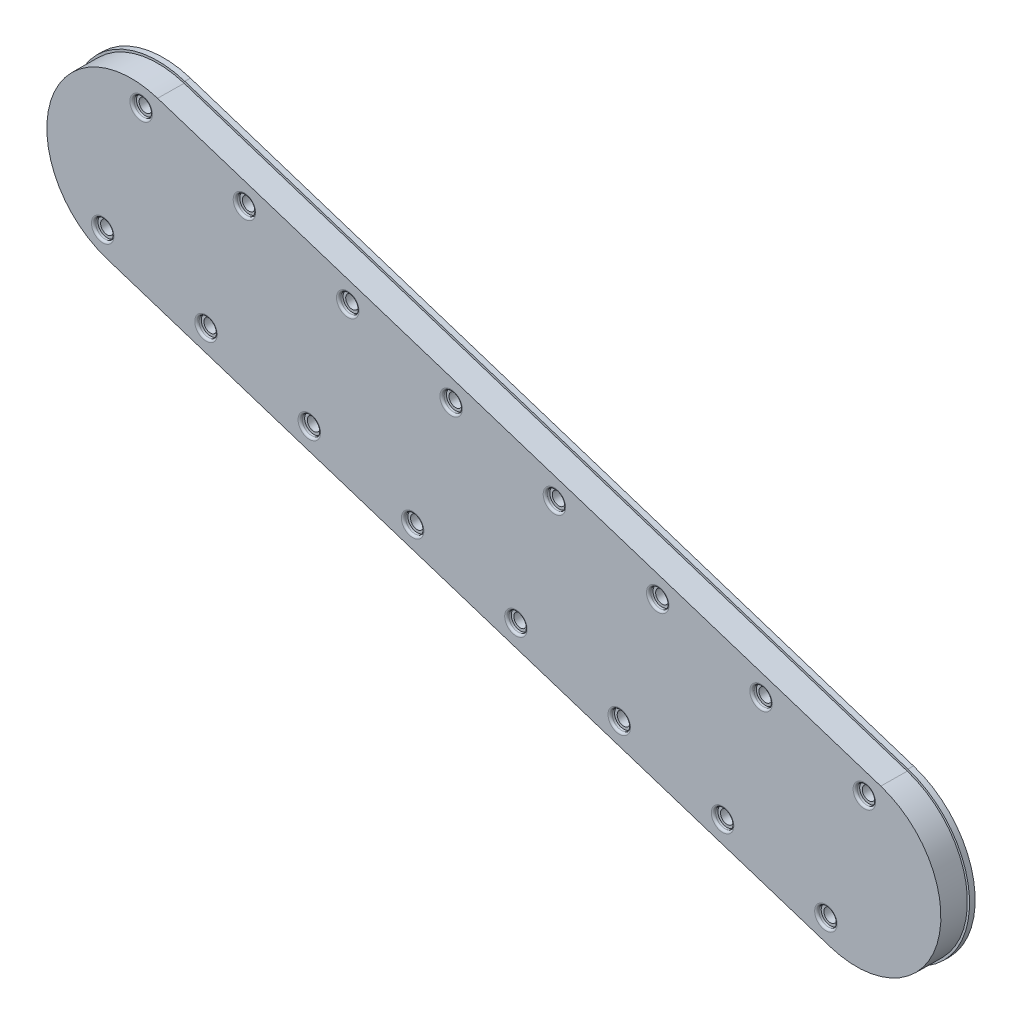
from build123d import *

# Parameters (mm, degrees)
BOSS_EXTRUDE1_DEPTH    = 2.54
BOSS_EXTRUDE2_DEPTH    = 12
SKETCH3_R              = 3
CUT_EXTRUDE1_DEPTH     = 639.959410762
SKETCH4_R              = 4.2
CUT_EXTRUDE2_DEPTH     = 2
FILLET1_R              = 1
LPATTERN1_COUNT        = 8
LPATTERN1_PITCH        = 50
FILLET1_OF_LPATTERN1_R = 1


# Read off the part's stored shape, not the designer's step: Mirror1
with BuildPart() as part:
    # Sketch1 → Boss-Extrude1 (new body)
    with BuildSketch(Plane(origin=(-1.421621009, 0, 139.992781934), x_dir=(0.9999484423879343, 0, 0.010154435776743197), z_dir=(-0.010154435776743197, 0, 0.9999484423879343))):
        with BuildLine():
            Line((-77.993264275, 332.680740714), (-412.255549389, 436.397675994))
            ThreePointArc((-412.255549389, 436.397675994), (-462.93838565, 409.719030815), (-436.259740471, 359.036194554))
            Line((-436.259740471, 359.036194554), (-101.997455353, 255.319259286))
            ThreePointArc((-101.997455353, 255.319259286), (-51.314619098, 281.997904463), (-77.993264275, 332.680740714))
        make_face()
    extrude(amount=BOSS_EXTRUDE1_DEPTH)

    # Sketch2 → Boss-Extrude2 (add)
    with BuildSketch(Plane(origin=(-1.447413276, 0, 142.532650978), x_dir=(0.9999484423879343, 0, 0.010154435776743197), z_dir=(-0.010154435776743197, 0, 0.9999484423879343))):
        with BuildLine():
            Line((-435.963392433, 359.991274572), (-101.701107314, 256.274339306))
            ThreePointArc((-101.701107314, 256.274339306), (-52.269699118, 282.294252502), (-78.289612313, 331.725660698))
            Line((-78.289612313, 331.725660698), (-412.551897427, 435.442595976))
            ThreePointArc((-412.551897427, 435.442595976), (-461.983305633, 409.422682777), (-435.963392433, 359.991274572))
        make_face()
    extrude(amount=BOSS_EXTRUDE2_DEPTH)

    # Sketch3 → Cut-Extrude1 (cut, through all)
    with BuildSketch(Plane(origin=(-1.569266505, 0, 154.532032287), x_dir=(0.9999484423879343, 0, 0.010154435776743227), z_dir=(-0.010154435776743227, 0, 0.9999484423879343))):
        with Locations((-85.880318763, 324.134140723)):
            Circle(SKETCH3_R)
    cut_extrude1 = extrude(amount=-CUT_EXTRUDE1_DEPTH, mode=Mode.SUBTRACT)

    # Sketch4 → Cut-Extrude2 (cut)
    with BuildSketch(Plane(origin=(-1.569266505, 0, 154.532032287), x_dir=(0.9999484423879343, 0, 0.010154435776743189), z_dir=(-0.010154435776743189, 0, 0.9999484423879343))):
        with Locations((-85.880318763, 324.134140723)):
            Circle(SKETCH4_R)
    cut_extrude2 = extrude(amount=-CUT_EXTRUDE2_DEPTH, mode=Mode.SUBTRACT)

    # Fillet1
    fillet1_edges = [part.edges().sort_by_distance(p)[0] for p in [
        (-91.644940941, 324.134140723, 153.617317475),
    ]]
    fillet(fillet1_edges, radius=FILLET1_R)

    # LPattern1: Cut-Extrude1, Cut-Extrude2 ×8
    with Locations(*[Vector(-0.9550307761281648, 0.29634803804027393, -0.009698298702128795) * (i * LPATTERN1_PITCH) for i in range(1, LPATTERN1_COUNT)]):
        add(cut_extrude1, mode=Mode.SUBTRACT)
        add(cut_extrude2, mode=Mode.SUBTRACT)

    # Fillet1 of LPattern1
    fillet1_of_lpattern1_edges = [part.edges().sort_by_distance(p)[0] for p in [
        (-139.396479748, 338.951542625, 153.13240254),
        (-187.148018554, 353.768944527, 152.647487605),
        (-234.899557361, 368.586346429, 152.16257267),
        (-282.651096167, 383.403748331, 151.677657735),
        (-330.402634973, 398.221150233, 151.192742799),
        (-378.15417378, 413.038552135, 150.707827864),
        (-425.905712586, 427.855954037, 150.222912929),
    ]]
    fillet(fillet1_of_lpattern1_edges, radius=FILLET1_OF_LPATTERN1_R)

    # Mirror1 outline → Mirror1 (revolve, cut)
    with BuildSketch(Plane(origin=(-437.916628168, 370.551152965, -4.447025554), x_dir=(0.9999484423879343, 0, 0.010154435776743204), z_dir=(0, 1, 0))):
        with BuildLine():
            Line((3, -152.54), (3, -140))
            Line((3, -140), (0, -140))
            Line((0, -140), (0, -154.54))
            Line((0, -154.54), (5.2, -154.54))
            ThreePointArc((5.2, -154.54), (4.492893219, -154.247106781), (4.2, -153.54))
            Line((4.2, -153.54), (4.2, -152.54))
            Line((4.2, -152.54), (3, -152.54))
        make_face()
    revolve(axis=Axis((-437.916628168, 370.551152965, -4.447025554), (0.010154435776743204, 0, -0.9999484423879343)), mode=Mode.SUBTRACT)

    # Mirror1 2 outline → Mirror1 2 (revolve, cut)
    with BuildSketch(Plane(origin=(-390.165089361, 355.733751063, -3.962110619), x_dir=(0.9999484423879343, 0, 0.010154435776743204), z_dir=(0, 1, 0))):
        with BuildLine():
            Line((3, -152.54), (3, -140))
            Line((3, -140), (0, -140))
            Line((0, -140), (0, -154.54))
            Line((0, -154.54), (5.2, -154.54))
            ThreePointArc((5.2, -154.54), (4.492893219, -154.247106781), (4.2, -153.54))
            Line((4.2, -153.54), (4.2, -152.54))
            Line((4.2, -152.54), (3, -152.54))
        make_face()
    revolve(axis=Axis((-390.165089361, 355.733751063, -3.962110619), (0.010154435776743204, 0, -0.9999484423879343)), mode=Mode.SUBTRACT)

    # Mirror1 3 outline → Mirror1 3 (revolve, cut)
    with BuildSketch(Plane(origin=(-342.413550555, 340.916349161, -3.477195684), x_dir=(0.9999484423879343, 0, 0.010154435776743204), z_dir=(0, 1, 0))):
        with BuildLine():
            Line((3, -152.54), (3, -140))
            Line((3, -140), (0, -140))
            Line((0, -140), (0, -154.54))
            Line((0, -154.54), (5.2, -154.54))
            ThreePointArc((5.2, -154.54), (4.492893219, -154.247106781), (4.2, -153.54))
            Line((4.2, -153.54), (4.2, -152.54))
            Line((4.2, -152.54), (3, -152.54))
        make_face()
    revolve(axis=Axis((-342.413550555, 340.916349161, -3.477195684), (0.010154435776743204, 0, -0.9999484423879343)), mode=Mode.SUBTRACT)

    # Mirror1 4 outline → Mirror1 4 (revolve, cut)
    with BuildSketch(Plane(origin=(-294.662011749, 326.098947259, -2.992280749), x_dir=(0.9999484423879343, 0, 0.010154435776743204), z_dir=(0, 1, 0))):
        with BuildLine():
            Line((3, -152.54), (3, -140))
            Line((3, -140), (0, -140))
            Line((0, -140), (0, -154.54))
            Line((0, -154.54), (5.2, -154.54))
            ThreePointArc((5.2, -154.54), (4.492893219, -154.247106781), (4.2, -153.54))
            Line((4.2, -153.54), (4.2, -152.54))
            Line((4.2, -152.54), (3, -152.54))
        make_face()
    revolve(axis=Axis((-294.662011749, 326.098947259, -2.992280749), (0.010154435776743204, 0, -0.9999484423879343)), mode=Mode.SUBTRACT)

    # Mirror1 5 outline → Mirror1 5 (revolve, cut)
    with BuildSketch(Plane(origin=(-246.910472942, 311.281545357, -2.507365814), x_dir=(0.9999484423879343, 0, 0.010154435776743204), z_dir=(0, 1, 0))):
        with BuildLine():
            Line((3, -152.54), (3, -140))
            Line((3, -140), (0, -140))
            Line((0, -140), (0, -154.54))
            Line((0, -154.54), (5.2, -154.54))
            ThreePointArc((5.2, -154.54), (4.492893219, -154.247106781), (4.2, -153.54))
            Line((4.2, -153.54), (4.2, -152.54))
            Line((4.2, -152.54), (3, -152.54))
        make_face()
    revolve(axis=Axis((-246.910472942, 311.281545357, -2.507365814), (0.010154435776743204, 0, -0.9999484423879343)), mode=Mode.SUBTRACT)

    # Mirror1 6 outline → Mirror1 6 (revolve, cut)
    with BuildSketch(Plane(origin=(-199.158934136, 296.464143455, -2.022450879), x_dir=(0.9999484423879343, 0, 0.010154435776743204), z_dir=(0, 1, 0))):
        with BuildLine():
            Line((3, -152.54), (3, -140))
            Line((3, -140), (0, -140))
            Line((0, -140), (0, -154.54))
            Line((0, -154.54), (5.2, -154.54))
            ThreePointArc((5.2, -154.54), (4.492893219, -154.247106781), (4.2, -153.54))
            Line((4.2, -153.54), (4.2, -152.54))
            Line((4.2, -152.54), (3, -152.54))
        make_face()
    revolve(axis=Axis((-199.158934136, 296.464143455, -2.022450879), (0.010154435776743204, 0, -0.9999484423879343)), mode=Mode.SUBTRACT)

    # Mirror1 7 outline → Mirror1 7 (revolve, cut)
    with BuildSketch(Plane(origin=(-151.407395329, 281.646741553, -1.537535944), x_dir=(0.9999484423879343, 0, 0.010154435776743204), z_dir=(0, 1, 0))):
        with BuildLine():
            Line((3, -152.54), (3, -140))
            Line((3, -140), (0, -140))
            Line((0, -140), (0, -154.54))
            Line((0, -154.54), (5.2, -154.54))
            ThreePointArc((5.2, -154.54), (4.492893219, -154.247106781), (4.2, -153.54))
            Line((4.2, -153.54), (4.2, -152.54))
            Line((4.2, -152.54), (3, -152.54))
        make_face()
    revolve(axis=Axis((-151.407395329, 281.646741553, -1.537535944), (0.010154435776743204, 0, -0.9999484423879343)), mode=Mode.SUBTRACT)

    # Mirror1 8 outline → Mirror1 8 (revolve, cut)
    with BuildSketch(Plane(origin=(-103.655856523, 266.829339651, -1.052621009), x_dir=(0.9999484423879343, 0, 0.010154435776743204), z_dir=(0, 1, 0))):
        with BuildLine():
            Line((3, -152.54), (3, -140))
            Line((3, -140), (0, -140))
            Line((0, -140), (0, -154.54))
            Line((0, -154.54), (5.2, -154.54))
            ThreePointArc((5.2, -154.54), (4.492893219, -154.247106781), (4.2, -153.54))
            Line((4.2, -153.54), (4.2, -152.54))
            Line((4.2, -152.54), (3, -152.54))
        make_face()
    revolve(axis=Axis((-103.655856523, 266.829339651, -1.052621009), (0.010154435776743204, 0, -0.9999484423879343)), mode=Mode.SUBTRACT)


solid = part.part
